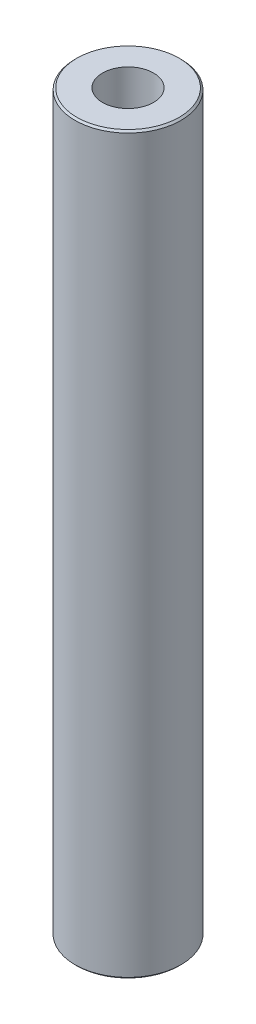
from build123d import *

# Parameters (mm, degrees)
SKETCH1_R           = 15
BOSS_EXTRUDE1_DEPTH = 207.952165961
SKETCH2_R           = 7.225163221
CUT_EXTRUDE1_DEPTH  = 210.031345323
CHAMFER1_SIZE       = 0.509180463


with BuildPart() as part:
    # Sketch1 → Boss-Extrude1 (new body)
    with BuildSketch(Plane(origin=(0, 0, 0), x_dir=(1, 0, 0), z_dir=(0, 1, 0))):
        Circle(SKETCH1_R)
    extrude(amount=BOSS_EXTRUDE1_DEPTH)

    # Sketch2 → Cut-Extrude1 (cut, through all)
    with BuildSketch(Plane(origin=(0, 0, 0), x_dir=(1, 0, 0), z_dir=(0, 1, 0))):
        Circle(SKETCH2_R)
    extrude(amount=CUT_EXTRUDE1_DEPTH, mode=Mode.SUBTRACT)

    # Chamfer1
    chamfer1_edges = [part.edges().sort_by_distance(p)[0] for p in [
        (-15, 207.952165961, 0),
        (-15, 0, 0),
    ]]
    chamfer(chamfer1_edges, length=CHAMFER1_SIZE)


solid = part.part
